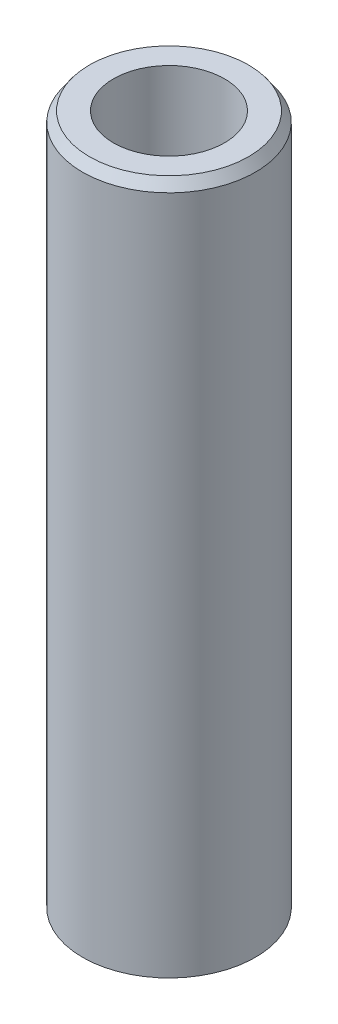
from build123d import *
from OCP.BRepFilletAPI import BRepFilletAPI_MakeChamfer

# Parameters (mm, degrees)
SKETCH1_R           = 25
BOSS_EXTRUDE1_DEPTH = 201.414738191
SKETCH2_R           = 16.055037596
CUT_EXTRUDE1_DEPTH  = 205.494246277
CHAMFER1_SIZE       = 2.86075442
CHAMFER1_SIZE2      = 2.007343883


with BuildPart() as part:
    # Sketch1 → Boss-Extrude1 (new body)
    with BuildSketch(Plane(origin=(0, 0, 0), x_dir=(1, 0, 0), z_dir=(0, 1, 0))):
        Circle(SKETCH1_R)
    extrude(amount=BOSS_EXTRUDE1_DEPTH)

    # Sketch2 → Cut-Extrude1 (cut, through all)
    with BuildSketch(Plane(origin=(0, 0, 0), x_dir=(1, 0, 0), z_dir=(0, 1, 0))):
        Circle(SKETCH2_R)
    extrude(amount=CUT_EXTRUDE1_DEPTH, mode=Mode.SUBTRACT)

    # Chamfer1: one chamfer whose edges measure the first distance from different faces: ONE call of the kernel's chamfer builder (chamfer() names one face for all edges)
    chamfer1_edges_1 = [part.edges().sort_by_distance(p)[0] for p in [
        (-25, 201.414738191, 0),
    ]]
    chamfer1_side_1 = [part.faces().sort_by_distance(p)[0] for p in [
        (-25, 100.707369096, 0),
    ]]
    chamfer1_edges_2 = [part.edges().sort_by_distance(p)[0] for p in [
        (-25, 0, 0),
    ]]
    chamfer1_side_2 = [part.faces().sort_by_distance(p)[0] for p in [
        (-24.292893219, 0, 0),
    ]]
    chamfer1 = BRepFilletAPI_MakeChamfer(part.part.solid().wrapped)
    for e in chamfer1_edges_1:
        chamfer1.Add(CHAMFER1_SIZE, CHAMFER1_SIZE2, e.wrapped, chamfer1_side_1[0].wrapped)  # the first distance lies on this face
    for e in chamfer1_edges_2:
        chamfer1.Add(CHAMFER1_SIZE, CHAMFER1_SIZE2, e.wrapped, chamfer1_side_2[0].wrapped)  # the first distance lies on this face
    add(Compound.cast(chamfer1.Shape()), mode=Mode.REPLACE)


solid = part.part
